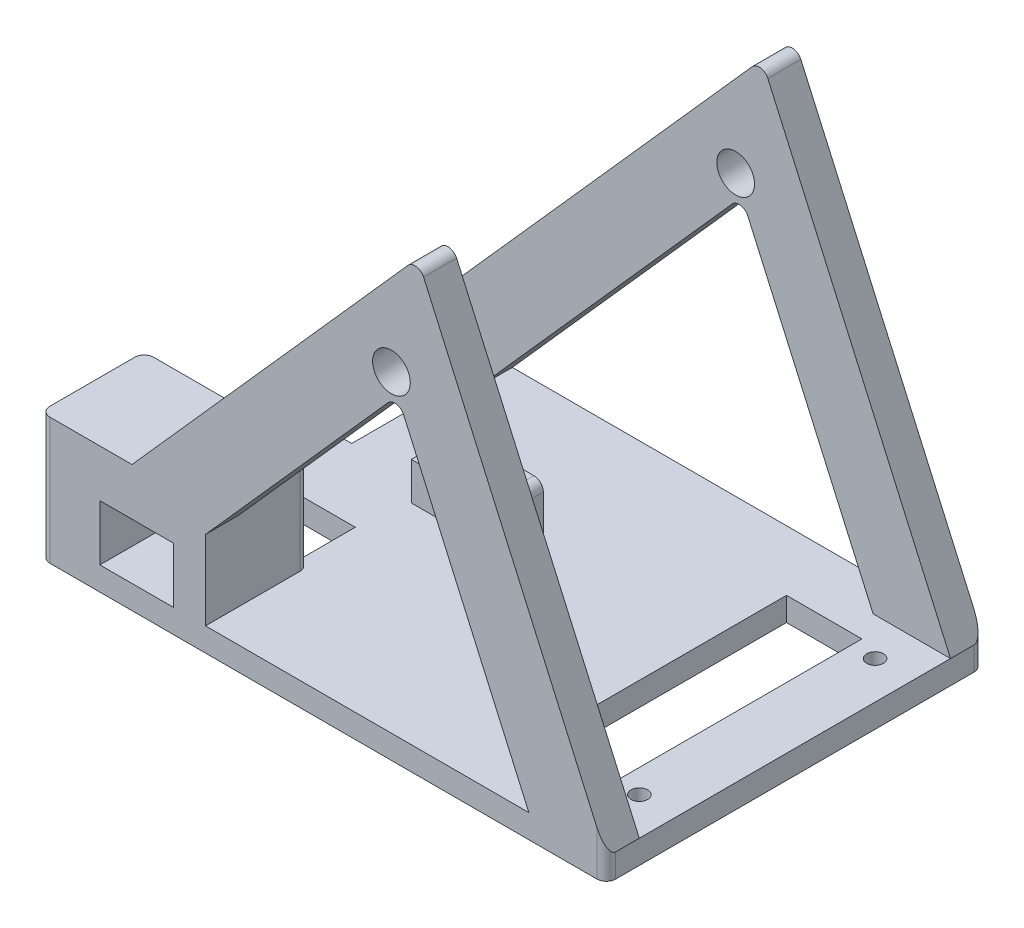
from build123d import *

# Parameters (mm, degrees)
SKETCH2_W               = 152.4
SKETCH2_H               = 101.6
BOSS_EXTRUDE1_DEPTH     = 6.35
BOSS_EXTRUDE2_DEPTH     = 8.89
FILLET1_R               = 2.54
SKETCH5_R               = 5.08
CUT_EXTRUDE1_DEPTH      = 192.880455786
MIRROR1_START           = 73.721650485
MIRROR1_OUTLINE_R       = 5.08
MIRROR1_DEPTH           = 8.89
SKETCH12_W              = 44.45
SKETCH12_H              = 27.736089271
BOSS_EXTRUDE4_DEPTH     = 19.05
BOSS_EXTRUDE5_DEPTH     = 8.89
CUT_EXTRUDE4_DEPTH      = 19.05
CUT_EXTRUDE4_DEPTH_BACK = 192.880455786
SKETCH12_4_W            = 19.8882
SKETCH12_4_H            = 14.986
CUT_EXTRUDE5_DEPTH      = 6.35
SKETCH18_W              = 20.32
SKETCH18_H              = 66.04
CUT_EXTRUDE6_DEPTH      = 6.35
SKETCH19_W              = 13.97
SKETCH19_H              = 22.86
CUT_EXTRUDE7_DEPTH      = 184.254753535
SKETCH20_R              = 2.25
SKETCH20_R_2            = 1.1303
CUT_EXTRUDE8_DEPTH      = 184.254753535
SKETCH21_W              = 10.16
SKETCH21_H              = 12.7
BOSS_EXTRUDE6_DEPTH     = 16.51
SKETCH22_W              = 12.7
SKETCH22_H              = 10.16
BOSS_EXTRUDE7_DEPTH     = 22.86
FILLET2_R               = 2.54
FILLET3_R               = 2.54


# Read off the part's stored shape, not the designer's step: Mirror1
with BuildPart() as part:
    # Sketch2 → Boss-Extrude1 (new body)
    with BuildSketch(Plane(origin=(0, 0, 0), x_dir=(1, 0, 0), z_dir=(0, 1, 0))):
        with Locations((42.826537217, -31.811650485)):
            Rectangle(SKETCH2_W, SKETCH2_H)
    extrude(amount=BOSS_EXTRUDE1_DEPTH)

    # Sketch4 → Boss-Extrude2 (add)
    with BuildSketch(Plane(origin=(0, 0, -18.988349515), x_dir=(-1, 0, 0), z_dir=(0, 0, -1))):
        Polygon((-98.179788203, 6.35), (-62.824718494, 85.898906846), (7.885420925, 6.35), (33.373462783, 6.35), (-68.226537217, 120.65), (-119.026537217, 6.35), align=None)
    extrude(amount=-BOSS_EXTRUDE2_DEPTH)

    # Fillet1
    fillet1_edges = [part.edges().sort_by_distance(p)[0] for p in [
        (62.824718494, 85.898906846, -14.543349515),
        (68.226537217, 120.65, -14.543349515),
    ]]
    fillet(fillet1_edges, radius=FILLET1_R)

    # Sketch5 → Cut-Extrude1 (cut, through all)
    with BuildSketch(Plane.XY.offset(-10.098349515)):
        with Locations((61.15629472, 90.616520913)):
            Circle(SKETCH5_R)
    extrude(amount=-CUT_EXTRUDE1_DEPTH, mode=Mode.SUBTRACT)

    # Mirror1 outline → Mirror1 (add)
    with BuildSketch(Plane.XY.offset(MIRROR1_START)):
        with BuildLine():
            ThreePointArc((60.206056328, 82.952911909), (62.494616288, 83.775286431), (64.425557331, 82.297019462))
            Line((64.425557331, 82.297019462), (98.179788203, 6.35))
            Line((98.179788203, 6.35), (119.026537217, 6.35))
            Line((119.026537217, 6.35), (69.827376054, 117.048112617))
            ThreePointArc((69.827376054, 117.048112617), (67.89643501, 118.526379585), (65.607875051, 117.704005063))
            Line((65.607875051, 117.704005063), (-33.373462783, 6.35))
            Line((-33.373462783, 6.35), (-7.885420925, 6.35))
            Line((-7.885420925, 6.35), (60.206056328, 82.952911909))
        make_face()
        with Locations((61.15629472, 90.616520913)):
            Circle(MIRROR1_OUTLINE_R, mode=Mode.SUBTRACT)
    extrude(amount=MIRROR1_DEPTH)

    # Sketch12 → Boss-Extrude4 (add)
    with BuildSketch(Plane(origin=(0, 0, 73.721650485), x_dir=(-1, 0, 0), z_dir=(0, 0, -1))):
        with Locations((11.148462783, 20.218044636)):
            Rectangle(SKETCH12_W, SKETCH12_H)
    extrude(amount=BOSS_EXTRUDE4_DEPTH)

    # Sketch15 → Boss-Extrude5 (add)
    with BuildSketch(Plane.XY.offset(73.721650485)):
        Polygon((-33.373462783, 34.086089271), (-33.373462783, 6.35), (-8.719161209, 34.086089271), align=None)
        Polygon((11.076537217, 27.682202909), (-7.885420925, 6.35), (11.076537217, 6.35), align=None)
    extrude(amount=BOSS_EXTRUDE5_DEPTH)

    # Sketch12<4> → Cut-Extrude4 (cut, two sides: drawn at the far end of the back side and taken through both)
    with BuildSketch(Plane(origin=(0, 0, 73.721650485), x_dir=(-1, 0, 0), z_dir=(0, 0, -1)).offset(-CUT_EXTRUDE4_DEPTH_BACK)):
        with Locations((7.42370528, 13.843)):
            Rectangle(SKETCH12_4_W, SKETCH12_4_H)
    extrude(amount=CUT_EXTRUDE4_DEPTH + CUT_EXTRUDE4_DEPTH_BACK, mode=Mode.SUBTRACT)

    # Sketch17 → Cut-Extrude5 (cut)
    with BuildSketch(Plane(origin=(0, 6.35, 0), x_dir=(1, 0, 0), z_dir=(0, 1, 0))):
        Polygon((-23.508558608, -40.828650485), (-9.633558608, -40.828650485), (-5.633558608, -40.828650485), (8.241441392, -40.828650485), (8.241441392, -39.431650485), (-23.508558608, -39.431650485), align=None)
        Polygon((-5.633558608, -40.828650485), (-9.633558608, -40.828650485), (-23.508558608, -40.828650485), (-23.508558608, -54.671650485), (-17.36780528, -54.671650485), (2.52039472, -54.671650485), (8.241441392, -54.671650485), (8.241441392, -40.828650485), align=None)
    extrude(amount=-CUT_EXTRUDE5_DEPTH, mode=Mode.SUBTRACT)

    # Sketch18 → Cut-Extrude6 (cut)
    with BuildSketch(Plane(origin=(0, 6.35, 0), x_dir=(1, 0, 0), z_dir=(0, 1, 0))):
        with Locations((92.356537217, -30.274439416)):
            Rectangle(SKETCH18_W, SKETCH18_H)
    extrude(amount=-CUT_EXTRUDE6_DEPTH, mode=Mode.SUBTRACT)

    # Sketch19 → Cut-Extrude7 (cut, through all)
    with BuildSketch(Plane(origin=(0, 6.35, 0), x_dir=(1, 0, 0), z_dir=(0, 1, 0))):
        with Locations((-18.768462783, -8.951650485)):
            Rectangle(SKETCH19_W, SKETCH19_H)
    extrude(amount=-CUT_EXTRUDE7_DEPTH, mode=Mode.SUBTRACT)

    # Sketch20 → Cut-Extrude8 (cut, through all)
    # profile 1 of 8: a face of its own
    with BuildSketch(Plane(origin=(0, 6.35, 0), x_dir=(1, 0, 0), z_dir=(0, 1, 0))):
        with Locations(Location((-29.563462783, -6.411650485, 0), (0, 0, 270))):
            Circle(SKETCH20_R)
        with Locations((-29.563462783, -6.411650485)):
            Circle(SKETCH20_R_2, mode=Mode.SUBTRACT)
    # profile 2 of 8: a face of its own
    with BuildSketch(Plane(origin=(0, 6.35, 0), x_dir=(1, 0, 0), z_dir=(0, 1, 0))):
        with Locations((-29.563462783, -6.411650485)):
            Circle(SKETCH20_R_2)
    # profile 3 of 8: a face of its own
    with BuildSketch(Plane(origin=(0, 6.35, 0), x_dir=(1, 0, 0), z_dir=(0, 1, 0))):
        with Locations(Location((-28.293462783, -44.511650485, 0), (0, 0, 270))):
            Circle(SKETCH20_R)
        with Locations((-28.293462783, -44.511650485)):
            Circle(SKETCH20_R_2, mode=Mode.SUBTRACT)
    # profile 4 of 8: a face of its own
    with BuildSketch(Plane(origin=(0, 6.35, 0), x_dir=(1, 0, 0), z_dir=(0, 1, 0))):
        with Locations((-28.293462783, -44.511650485)):
            Circle(SKETCH20_R_2)
    # profile 5 of 8: a face of its own
    with BuildSketch(Plane(origin=(0, 6.35, 0), x_dir=(1, 0, 0), z_dir=(0, 1, 0))):
        with Locations(Location((108.866537217, -0.061650485, 0), (0, 0, 270))):
            Circle(SKETCH20_R)
        with Locations((108.866537217, -0.061650485)):
            Circle(SKETCH20_R_2, mode=Mode.SUBTRACT)
    # profile 6 of 8: a face of its own
    with BuildSketch(Plane(origin=(0, 6.35, 0), x_dir=(1, 0, 0), z_dir=(0, 1, 0))):
        with Locations((108.866537217, -0.061650485)):
            Circle(SKETCH20_R_2)
    # profile 7 of 8: a face of its own
    with BuildSketch(Plane(origin=(0, 6.35, 0), x_dir=(1, 0, 0), z_dir=(0, 1, 0))):
        with Locations(Location((108.866537217, -63.561650485, 0), (0, 0, 270))):
            Circle(SKETCH20_R)
        with Locations((108.866537217, -63.561650485)):
            Circle(SKETCH20_R_2, mode=Mode.SUBTRACT)
    # profile 8 of 8: a face of its own
    with BuildSketch(Plane(origin=(0, 6.35, 0), x_dir=(1, 0, 0), z_dir=(0, 1, 0))):
        with Locations((108.866537217, -63.561650485)):
            Circle(SKETCH20_R_2)
    extrude(amount=-CUT_EXTRUDE8_DEPTH, mode=Mode.SUBTRACT)

    # Sketch21 → Boss-Extrude6 (add)
    with BuildSketch(Plane(origin=(0, 6.35, 0), x_dir=(1, 0, 0), z_dir=(0, 1, 0))):
        with Locations((34.258952171, -26.223650485)):
            Rectangle(SKETCH21_W, SKETCH21_H)
    extrude(amount=BOSS_EXTRUDE6_DEPTH)

    # Sketch22 → Boss-Extrude7 (add)
    with BuildSketch(Plane(origin=(39.338952171, 0, 0), x_dir=(0, 0, -1), z_dir=(1, 0, 0))):
        with Locations((-26.223650485, 17.78)):
            Rectangle(SKETCH22_W, SKETCH22_H)
    extrude(amount=-BOSS_EXTRUDE7_DEPTH)

    # Fillet2
    fillet2_edges = [part.edges().sort_by_distance(p)[0] for p in [
        (39.338952171, 22.86, 26.223650485),
    ]]
    fillet(fillet2_edges, radius=FILLET2_R)

    # Fillet3
    fillet3_edges = [part.edges().sort_by_distance(p)[0] for p in [
        (11.076537217, 20.218044635, 54.671650485),
        (-33.373462783, 20.218044635, 54.671650485),
        (-33.373462783, 3.175, -18.988349515),
        (119.026537217, 3.175, -18.988349515),
        (119.026537217, 3.175, 82.611650485),
        (-33.373462783, 17.043044635, 82.611650485),
    ]]
    fillet(fillet3_edges, radius=FILLET3_R)


solid = part.part
